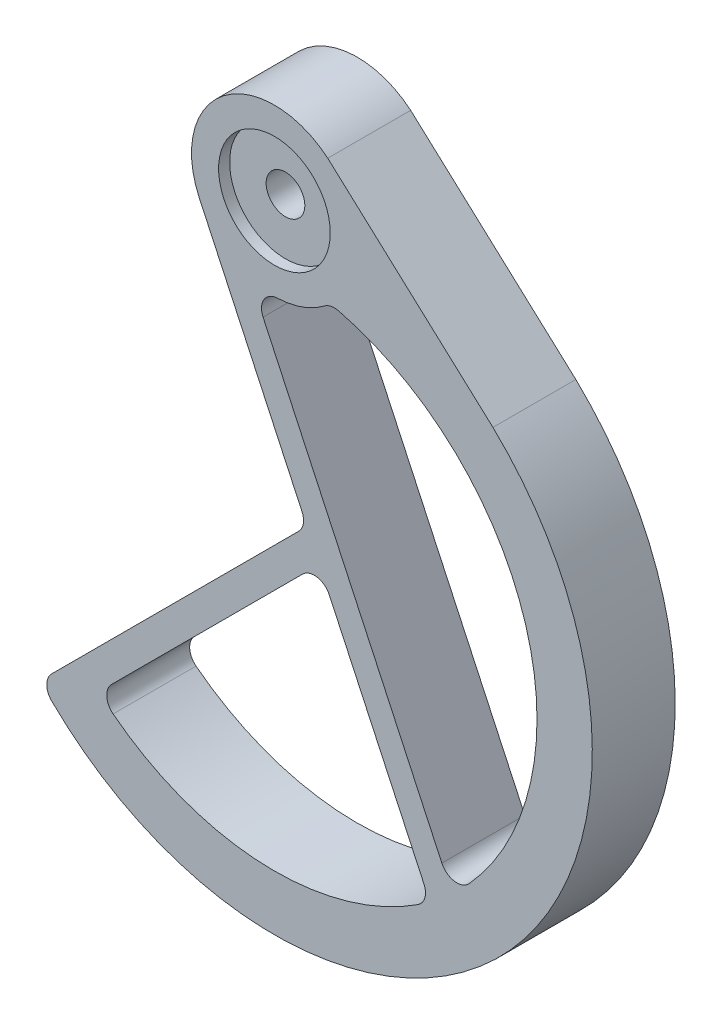
from build123d import *

# Parameters (mm, degrees)
EXTRUDE_1_DEPTH     = 15
SKETCH_6_R          = 3.5
CUT_EXTRUDE_2_DEPTH = 15
SKETCH_7_R          = 10.1
CUT_EXTRUDE_3_DEPTH = 2


with BuildPart() as part:
    # ｽｹｯﾁ1 → ﾎﾞｽ - 押し出し1 (new body)
    with BuildSketch(Plane.XY):
        with BuildLine():
            Line((10.546944731, 68.165925034), (9.641814145, 68.990666647))
            ThreePointArc((9.641814145, 68.990666647), (-9.131421435, 69.400300104), (-13.594616806, 51.160726074))
            Line((-13.594616806, 51.160726074), (4.986432096, 11.313538113))
            ThreePointArc((4.986432096, 11.313538113), (5.221931994, 9.524738795), (4.388829079, 7.924362985))
            Line((4.388829079, 7.924362985), (-40.303464689, -36.767930783))
            ThreePointArc((-40.303464689, -36.767930783), (-41.182112782, -38.903012739), (-40.283913759, -41.029943849))
            ThreePointArc((-40.283913759, -41.029943849), (41.397896806, -39.905690573), (39.524106652, 41.762363359))
            Line((39.524106652, 41.762363359), (37.916838192, 43.226882625))
            Line((37.916838192, 43.226882625), (10.546944731, 68.165925034))
        make_face()
        with BuildLine():
            ThreePointArc((5.093338956, 1.55780505), (7.735603832, 2.390907965), (9.933582661, 0.704339492))
            Line((9.933582661, 0.704339492), (27.046217634, -35.993824637))
            ThreePointArc((27.046217634, -35.993824637), (27.212084573, -38.085077821), (25.967336583, -39.773702754))
            ThreePointArc((25.967336583, -39.773702754), (-1.972837213, -47.459012983), (-29.17877254, -37.481318454))
            ThreePointArc((-29.17877254, -37.481318454), (-30.330146685, -35.299826939), (-29.457223039, -32.992756945))
            Line((-29.457223039, -32.992756945), (5.093338956, 1.55780505))
        make_face(mode=Mode.SUBTRACT)
        with BuildLine():
            ThreePointArc((35.231836325, -31.858557864), (32.560090836, -32.813013733), (30.287744354, -31.114293205))
            Line((30.287744354, -31.114293205), (-2.054746852, 38.244403012))
            ThreePointArc((-2.054746852, 38.244403012), (-1.895310582, 41.077194163), (0.553480425, 42.510214831))
            ThreePointArc((0.553480425, 42.510214831), (5.039223996, 43.371793408), (9.057681155, 45.543478261))
            ThreePointArc((9.057681155, 45.543478261), (10.270904088, 46.091905397), (11.601973614, 46.061309233))
            ThreePointArc((11.601973614, 46.061309233), (45.455779175, 13.784851815), (35.231836325, -31.858557864))
        make_face(mode=Mode.SUBTRACT)
    extrude(amount=EXTRUDE_1_DEPTH)

    # ｽｹｯﾁ6 → ｶｯﾄ - 押し出し2 (cut)
    with BuildSketch(Plane.XY.offset(15)):
        with Locations((0, 57.5)):
            Circle(SKETCH_6_R)
    extrude(amount=-CUT_EXTRUDE_2_DEPTH, mode=Mode.SUBTRACT)

    # ｽｹｯﾁ7 → ｶｯﾄ - 押し出し3 (cut)
    with BuildSketch(Plane.XY.offset(15)):
        with Locations((0, 57.5)):
            Circle(SKETCH_7_R)
    extrude(amount=-CUT_EXTRUDE_3_DEPTH, mode=Mode.SUBTRACT)


solid = part.part
